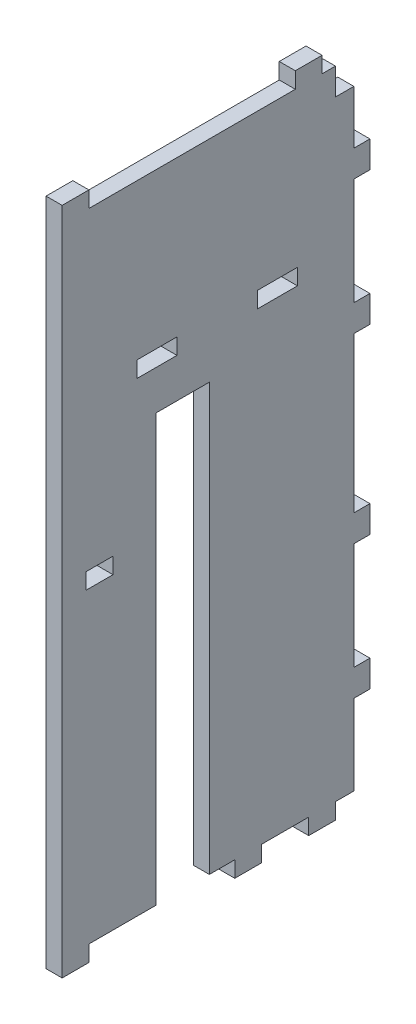
from build123d import *

# Parameters (mm, degrees)
ESQUISSE1_W             = 109
ESQUISSE1_H             = 238
ESQUISSE1_W_2           = 10
ESQUISSE1_H_2           = 6
ESQUISSE1_W_3           = 15
BOSS_EXTRU_1_DEPTH      = 6
ESQUISSE3_W             = 10
ESQUISSE3_H             = 6
ESQUISSE3_W_2           = 6
ESQUISSE3_H_2           = 10
BOSS_EXTRU_5_DEPTH      = 6
ESQUISSE6_W             = 20
ESQUISSE6_H             = 159.29
ENL_V_MAT_EXTRU_2_DEPTH = 6
ESQUISSE7_W             = 6.88
ESQUISSE7_H             = 10
ENL_V_MAT_EXTRU_3_DEPTH = 6


with BuildPart() as part:
    # Esquisse1 → Boss.-Extru.1 (new body)
    with BuildSketch(Plane(origin=(0, 0, 0), x_dir=(0, 0, -1), z_dir=(1, 0, 0))):
        Rectangle(ESQUISSE1_W, ESQUISSE1_H)
        with Locations((-40.5, -1)):
            Rectangle(ESQUISSE1_W_2, ESQUISSE1_H_2, mode=Mode.SUBTRACT)
        with Locations((-19.085, 58)):
            Rectangle(ESQUISSE1_W_3, ESQUISSE1_H_2, mode=Mode.SUBTRACT)
        with Locations((25.915, 58)):
            Rectangle(ESQUISSE1_W_3, ESQUISSE1_H_2, mode=Mode.SUBTRACT)
    extrude(amount=BOSS_EXTRU_1_DEPTH)

    # Esquisse3 → Boss.-Extru.5 (add)
    with BuildSketch(Plane(origin=(6, 0, 0), x_dir=(0, 0, -1), z_dir=(1, 0, 0))):
        with Locations((-49.5, -122)):
            Rectangle(ESQUISSE3_W, ESQUISSE3_H)
        with Locations((42.62, -122)):
            Rectangle(ESQUISSE3_W, ESQUISSE3_H)
        with Locations((57.5, 34)):
            Rectangle(ESQUISSE3_W_2, ESQUISSE3_H_2)
        with Locations((57.5, 84)):
            Rectangle(ESQUISSE3_W_2, ESQUISSE3_H_2)
        with Locations((57.5, -84)):
            Rectangle(ESQUISSE3_W_2, ESQUISSE3_H_2)
        with Locations((57.5, -34)):
            Rectangle(ESQUISSE3_W_2, ESQUISSE3_H_2)
        with Locations((15, -122)):
            Rectangle(ESQUISSE3_W, ESQUISSE3_H)
        with Locations((37.62, 122)):
            Rectangle(ESQUISSE3_W, ESQUISSE3_H)
        with Locations((-49.5, 122)):
            Rectangle(ESQUISSE3_W, ESQUISSE3_H)
    extrude(amount=-BOSS_EXTRU_5_DEPTH)

    # Esquisse6 → Enlèv. mat.-Extru.2 (cut)
    with BuildSketch(Plane(origin=(6, 0, 0), x_dir=(0, 0, -1), z_dir=(1, 0, 0))):
        with Locations((-9.5, -39.355)):
            Rectangle(ESQUISSE6_W, ESQUISSE6_H)
    extrude(amount=-ENL_V_MAT_EXTRU_2_DEPTH, mode=Mode.SUBTRACT)

    # Esquisse7 → Enlèv. mat.-Extru.3 (cut)
    with BuildSketch(Plane.ZY):
        with Locations((-51.06, 114)):
            Rectangle(ESQUISSE7_W, ESQUISSE7_H)
    extrude(amount=-ENL_V_MAT_EXTRU_3_DEPTH, mode=Mode.SUBTRACT)


solid = part.part
